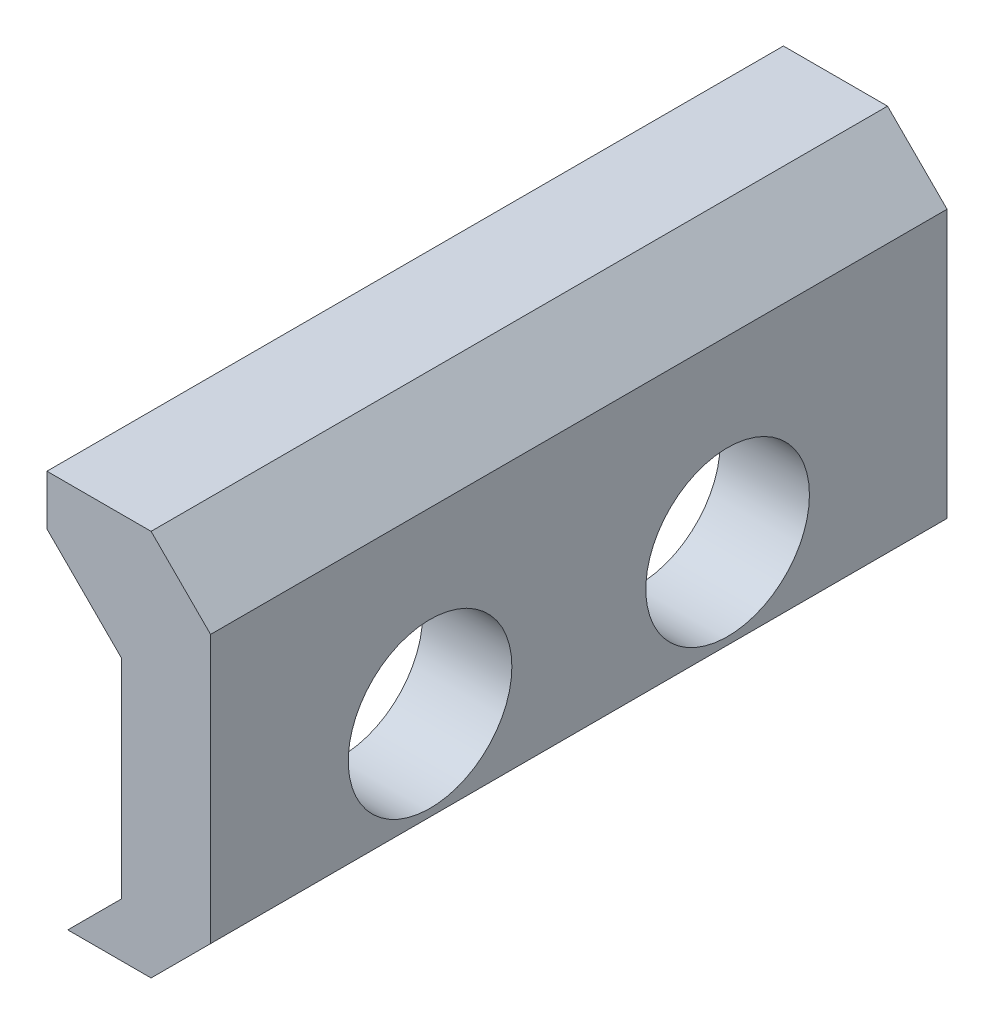
from build123d import *

# Parameters (mm, degrees)
DODANIE_WYCI_GNI_CIE1_DEPTH = 24.75
SZKIC2_R                    = 2.75
WYTNIJ_WYCI_GNI_CIE1_DEPTH  = 4.2
CHAMFER1_SIZE               = 2


with BuildPart() as part:
    # Szkic1 → Dodanie-wyciągnięcie1 (new body)
    with BuildSketch(Plane.XY):
        Polygon((3, -8.82), (-1.8, -8.82), (0, -7.02), (0, 0), (-2.5, 2.5), (-2.5, 4.18), (3, 4.18), align=None)
    extrude(amount=DODANIE_WYCI_GNI_CIE1_DEPTH)

    # Szkic2 → Wytnij-wyciągnięcie1 (cut)
    with BuildSketch(Plane(origin=(3, 0, 0), x_dir=(0, 0, -1), z_dir=(1, 0, 0))):
        with Locations((-17.375, -3.82)):
            Circle(SZKIC2_R)
        with Locations((-7.375, -3.82)):
            Circle(SZKIC2_R)
    extrude(amount=-WYTNIJ_WYCI_GNI_CIE1_DEPTH, mode=Mode.SUBTRACT)

    # Chamfer1
    chamfer1_edges = [part.edges().sort_by_distance(p)[0] for p in [
        (3, -8.82, 12.375),
        (3, 4.18, 12.375),
    ]]
    chamfer(chamfer1_edges, length=CHAMFER1_SIZE)


solid = part.part
